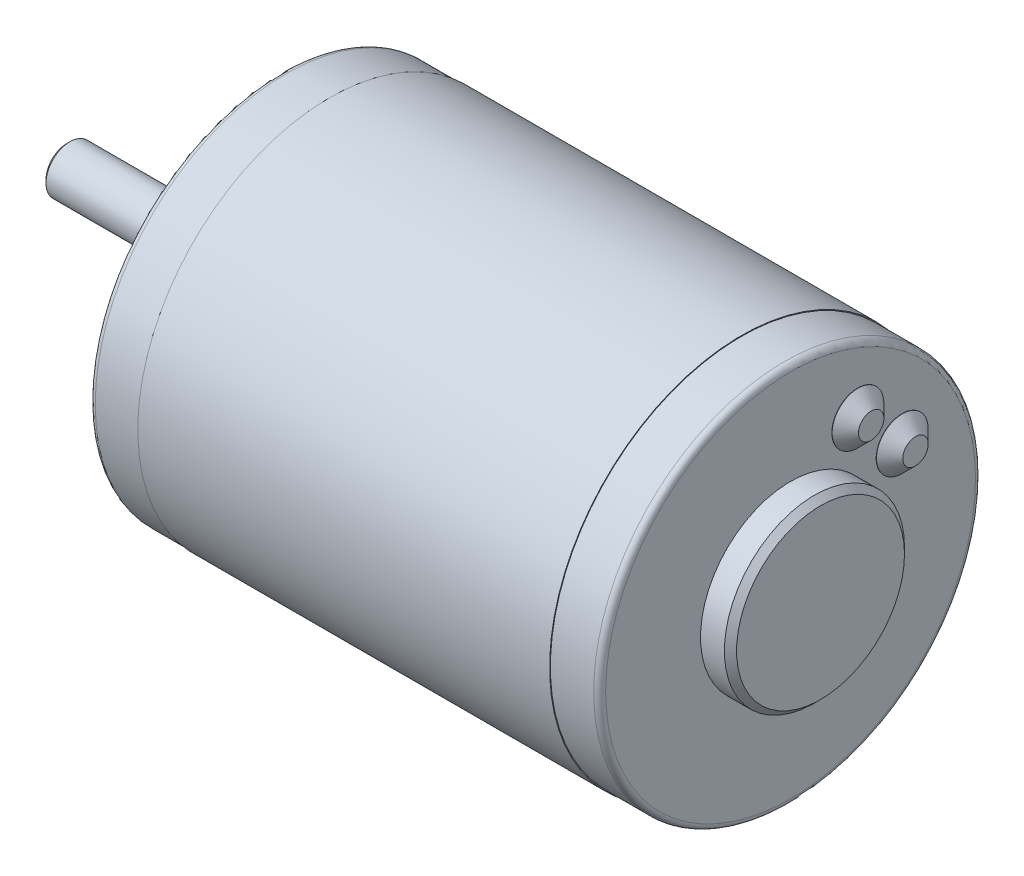
from build123d import *

# Parameters (mm, degrees)
SKETCH1_W                       = 68.7568
SKETCH1_H                       = 32.004
SKETCH2_R                       = 31.877
BOSS_EXTRUDE1_DEPTH             = 8.2296
SKETCH3_R                       = 15.0368
BOSS_EXTRUDE2_DEPTH             = 5
BOSS_EXTRUDE3_START             = 8.2296
SKETCH4_R                       = 31.877
BOSS_EXTRUDE3_DEPTH             = 8.2296
SKETCH5_R                       = 9.525
BOSS_EXTRUDE4_DEPTH             = 4
SKETCH6_R                       = 4
BOSS_EXTRUDE5_DEPTH             = 31.6
F_21_0_159_DIAMETER_HOLE1_D     = 4.0386
F_21_0_159_DIAMETER_HOLE1_DEPTH = 13.6144
F_21_0_159_DIAMETER_HOLE1_TIP   = 1.213317848
CHAMFER1_SIZE                   = 1.016
CHAMFER2_SIZE                   = 0.5
FILLET1_R                       = 1


with BuildPart() as part:
    # Sketch1 → Revolve1 (revolve)
    with BuildSketch(Plane.XY):
        with Locations((42.608, 16.002)):
            Rectangle(SKETCH1_W, SKETCH1_H)
    revolve(axis=Axis((8.2296, 0, 0), (1, 0, 0)))

    # Sketch2 → Boss-Extrude1 (add)
    with BuildSketch(Plane(origin=(76.9864, 0, 0), x_dir=(0, 0, -1), z_dir=(1, 0, 0))):
        Circle(SKETCH2_R)
    extrude(amount=BOSS_EXTRUDE1_DEPTH)

    # Sketch3 → Boss-Extrude2 (add)
    with BuildSketch(Plane(origin=(85.216, 0, 0), x_dir=(0, 0, -1), z_dir=(1, 0, 0))):
        Circle(SKETCH3_R)
    extrude(amount=BOSS_EXTRUDE2_DEPTH)

    # Sketch4 → Boss-Extrude3 (add)
    with BuildSketch(Plane.ZY.offset(-8.2296).offset(BOSS_EXTRUDE3_START)):
        Circle(SKETCH4_R)
    extrude(amount=-BOSS_EXTRUDE3_DEPTH)

    # Sketch5 → Boss-Extrude4 (add)
    with BuildSketch(Plane.ZY):
        Circle(SKETCH5_R)
    extrude(amount=BOSS_EXTRUDE4_DEPTH)

    # Sketch6 → Boss-Extrude5 (add)
    with BuildSketch(Plane.ZY.offset(4)):
        Circle(SKETCH6_R)
    extrude(amount=BOSS_EXTRUDE5_DEPTH)

    # Sketch8 → Revolve2 (revolve)
    with BuildSketch(Plane.XY.offset(-18.607090683)):
        Polygon((85.216, 15.525359639), (85.216, 11.207359639), (87.4639, 11.207359639), (87.4639, 13.325359639), (85.2639, 15.525359639), align=None)
    revolve(axis=Axis((85.216, 11.207359639, -18.607090683), (1, 0, 0)))

    # Sketch9 → Revolve3 (revolve)
    with BuildSketch(Plane.XY.offset(-11.207359639)):
        Polygon((85.216, 22.925090683), (85.216, 18.607090683), (87.4639, 18.607090683), (87.4639, 20.725090683), (85.2639, 22.925090683), align=None)
    revolve(axis=Axis((85.216, 18.607090683, -11.207359639), (1, 0, 0)))

    # #21 (0.159) Diameter Hole1
    with Locations(Plane.ZY):
        with Locations((0, 25.4), (0, -25.4)):
            Hole(F_21_0_159_DIAMETER_HOLE1_D / 2, depth=F_21_0_159_DIAMETER_HOLE1_DEPTH)
            with Locations((0, 0, -(F_21_0_159_DIAMETER_HOLE1_DEPTH + F_21_0_159_DIAMETER_HOLE1_TIP / 2))):  # 118° drill point
                Cone(0, F_21_0_159_DIAMETER_HOLE1_D / 2, F_21_0_159_DIAMETER_HOLE1_TIP, mode=Mode.SUBTRACT)

    # Chamfer1
    chamfer1_edges = [part.edges().sort_by_distance(p)[0] for p in [
        (-4, 0, -9.525),
        (90.216, 0, 15.0368),
    ]]
    chamfer(chamfer1_edges, length=CHAMFER1_SIZE)

    # Chamfer2
    chamfer2_edges = [part.edges().sort_by_distance(p)[0] for p in [
        (-35.6, 0, -4),
    ]]
    chamfer(chamfer2_edges, length=CHAMFER2_SIZE)

    # Fillet1
    fillet1_edges = [part.edges().sort_by_distance(p)[0] for p in [
        (0, 0, -31.877),
        (85.216, 0, 31.877),
    ]]
    fillet(fillet1_edges, radius=FILLET1_R)


solid = part.part
